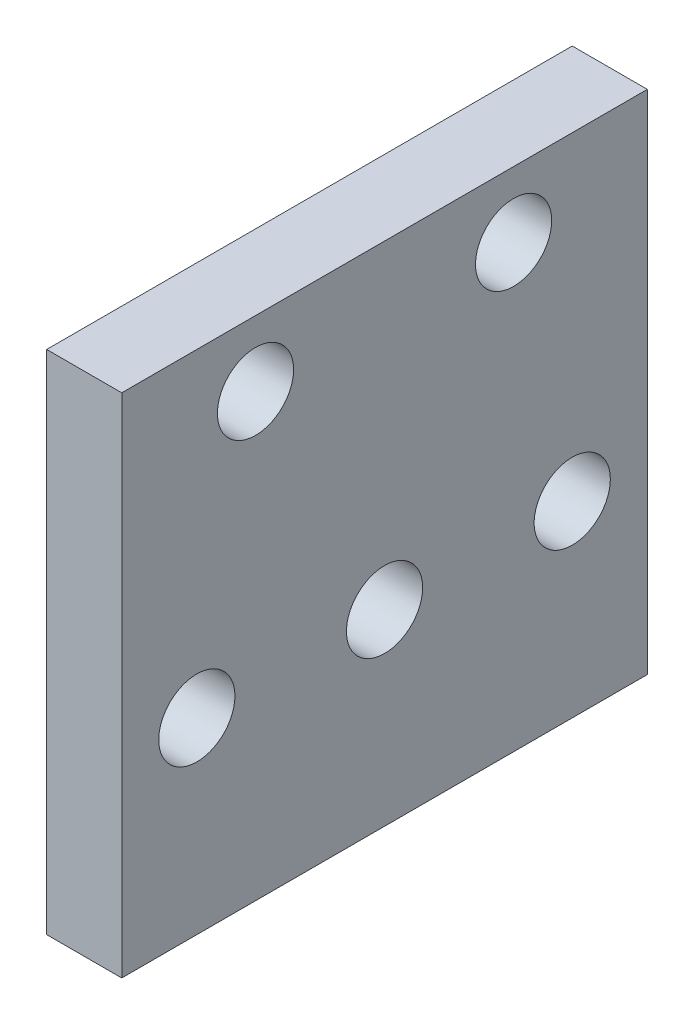
from build123d import *

# Parameters (mm, degrees)
SKETCH1_W           = 35.56
SKETCH1_H           = 34.29
BOSS_EXTRUDE1_DEPTH = 5.08
SKETCH2_R           = 2.5781
CUT_EXTRUDE1_DEPTH  = 26.216776658


with BuildPart() as part:
    # Sketch1 → Boss-Extrude1 (new body)
    with BuildSketch(Plane(origin=(0, 0, 0), x_dir=(0, 0, -1), z_dir=(1, 0, 0))):
        Rectangle(SKETCH1_W, SKETCH1_H)
    extrude(amount=BOSS_EXTRUDE1_DEPTH)

    # Sketch2 → Cut-Extrude1 (cut, through all)
    with BuildSketch(Plane(origin=(5.08, 0, 0), x_dir=(0, 0, -1), z_dir=(1, 0, 0))):
        with Locations((-8.73125, 12.7)):
            Circle(SKETCH2_R)
        with Locations((8.73125, 12.7)):
            Circle(SKETCH2_R)
        with Locations((-12.7, -4.445)):
            Circle(SKETCH2_R)
        with Locations((0, -4.445)):
            Circle(SKETCH2_R)
        with Locations((12.7, -4.445)):
            Circle(SKETCH2_R)
    extrude(amount=-CUT_EXTRUDE1_DEPTH, mode=Mode.SUBTRACT)


solid = part.part
